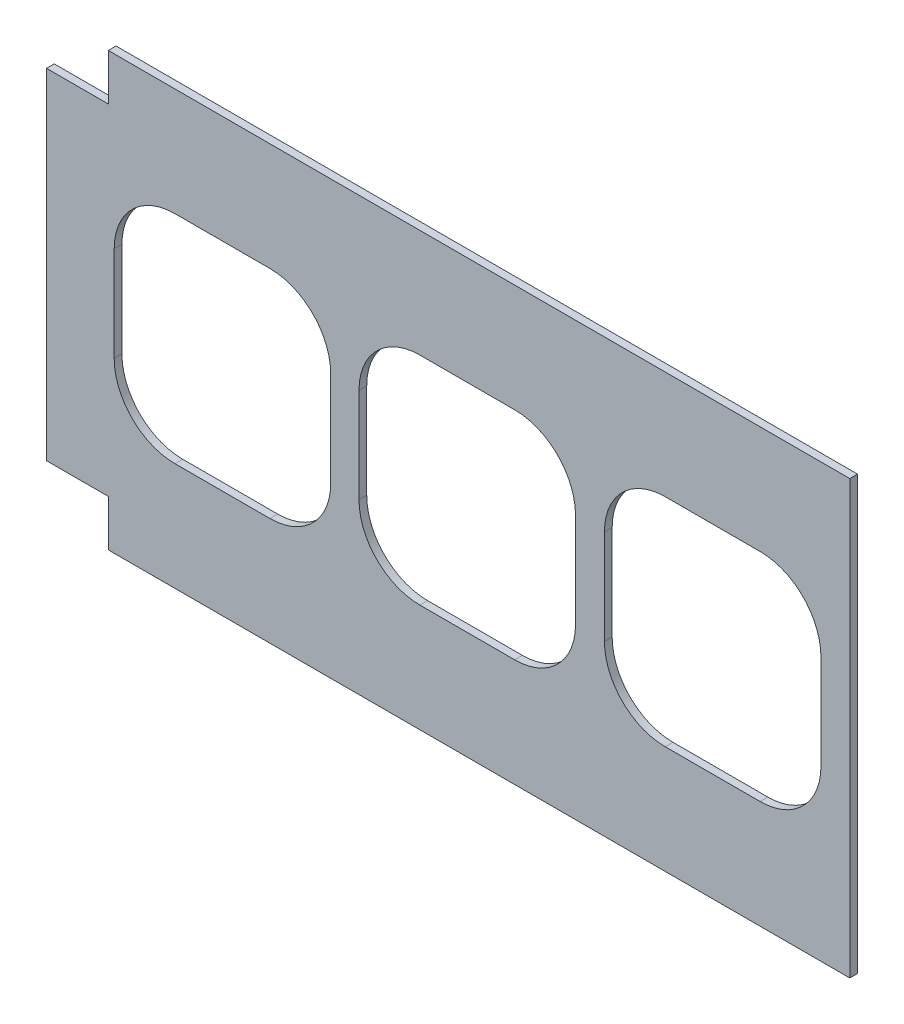
from build123d import *

# Parameters (mm, degrees)
SKETCH1_W           = 89
SKETCH1_H           = 89
BOSS_EXTRUDE1_DEPTH = 3.175
FILLET1_R           = 25


with BuildPart() as part:
    # Sketch1 → Boss-Extrude1 (new body)
    with BuildSketch(Plane.XY):
        Polygon((-152.4, -88.9), (152.4, -88.9), (152.4, 88.9), (-152.4, 88.9), (-152.4, 69.85), (-177.8, 69.85), (-177.8, -69.85), (-152.4, -69.85), align=None)
        with Locations((96.05, 0)):
            Rectangle(SKETCH1_W, SKETCH1_H, mode=Mode.SUBTRACT)
        with Locations((-105.474, 0)):
            Rectangle(SKETCH1_W, SKETCH1_H, mode=Mode.SUBTRACT)
        with Locations((-4.839, 0)):
            Rectangle(SKETCH1_W, SKETCH1_H, mode=Mode.SUBTRACT)
    extrude(amount=BOSS_EXTRUDE1_DEPTH)

    # Fillet1
    fillet1_edges = [part.edges().sort_by_distance(p)[0] for p in [
        (140.55, -44.5, 1.5875),
        (51.55, -44.5, 1.5875),
        (51.55, 44.5, 1.5875),
        (140.55, 44.5, 1.5875),
        (-149.974, 44.5, 1.5875),
        (-149.974, -44.5, 1.5875),
        (-60.974, -44.5, 1.5875),
        (-60.974, 44.5, 1.5875),
        (-49.339, 44.5, 1.5875),
        (39.661, 44.5, 1.5875),
        (39.661, -44.5, 1.5875),
        (-49.339, -44.5, 1.5875),
    ]]
    fillet(fillet1_edges, radius=FILLET1_R)


solid = part.part
